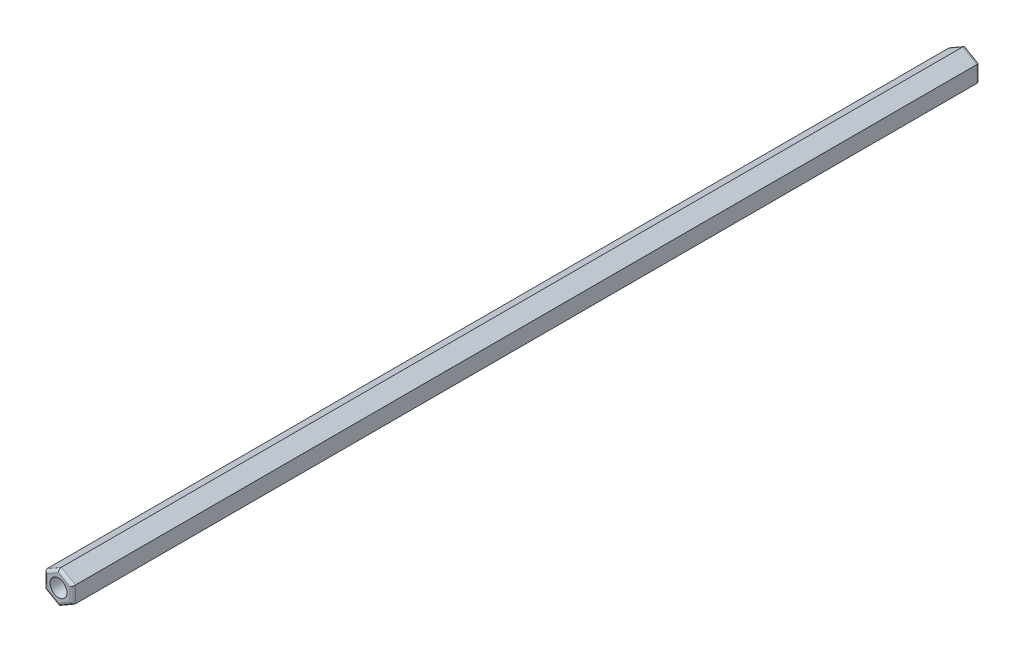
from build123d import *

# Parameters (mm, degrees)
RESSALTO_EXTRUS_O1_DEPTH = 160
FILETE1_R                = 0.5
ESBO_O2_R                = 1.5
CORTE_EXTRUS_O1_DEPTH    = 176.684066226


with BuildPart() as part:
    # Esboço1 → Ressalto-extrusão1 (new body)
    with BuildSketch(Plane(origin=(0, 0, 0), x_dir=(-1, 0, 0), z_dir=(0, 0, -1))):
        Polygon((67.502122675, -1.443375673), (70.002122675, -2.886751346), (72.502122675, -1.443375673), (72.502122675, 1.443375673), (70.002122675, 2.886751346), (67.502122675, 1.443375673), align=None)
    extrude(amount=-RESSALTO_EXTRUS_O1_DEPTH)

    # Filete1
    filete1_edges = [part.edges().sort_by_distance(p)[0] for p in [
        (-71.252122675, 2.165063509, 0),
        (-72.502122675, 0, 0),
        (-68.752122675, 2.165063509, 0),
        (-71.252122675, -2.165063509, 0),
        (-67.502122675, 0, 0),
        (-68.752122675, -2.165063509, 0),
        (-71.252122675, 2.165063509, 160),
        (-72.502122675, 0, 160),
        (-68.752122675, 2.165063509, 160),
        (-71.252122675, -2.165063509, 160),
        (-67.502122675, 0, 160),
        (-68.752122675, -2.165063509, 160),
    ]]
    fillet(filete1_edges, radius=FILETE1_R)

    # Esboço2 → Corte-extrusão1 (cut, through all)
    with BuildSketch(Plane.XY.offset(160)):
        with Locations((-70.002122675, 0)):
            Circle(ESBO_O2_R)
    extrude(amount=-CORTE_EXTRUS_O1_DEPTH, mode=Mode.SUBTRACT)


solid = part.part
